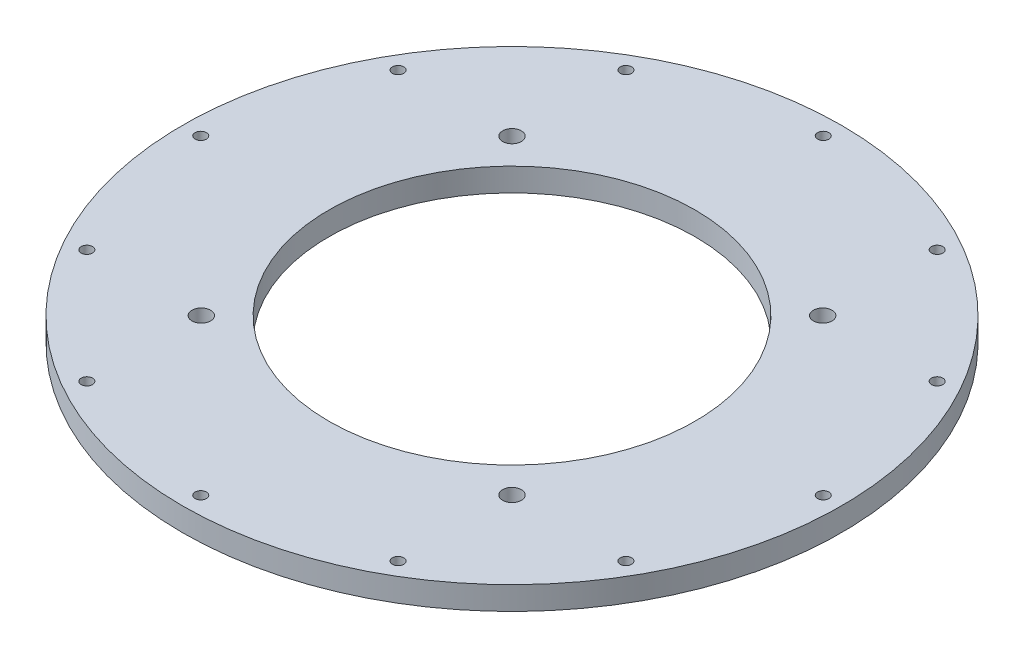
from build123d import *

# Parameters (mm, degrees)
CUT_EXTRUDE1_START       = -6.35
CUT_EXTRUDE1_OUTLINE_R   = 2.55
CUT_EXTRUDE1_OUTLINE_R_2 = 1.55
CUT_EXTRUDE1_DEPTH       = 6.35


# Read off the part's stored shape, not the designer's step: Cut-Extrude1
with BuildPart() as part:
    # Sketch1 → Revolve1 (revolve)
    with BuildSketch(Plane.XY, mode=Mode.PRIVATE) as revolve1_sk:
        with BuildLine():
            Line((90, 6.35), (50, 6.35))
            Line((50, 6.35), (50, 0))
            Line((50, 0), (75.3, 0))
            add(Edge.make_bspline(
                [(81.8, 0), (81.8, 2.165), (78.55, 2.165), (75.3, 2.165), (75.3, 0)],
                knots=[0, 0, 0, 1.570796327, 1.570796327, 3.141592654, 3.141592654, 3.141592654], degree=2, weights=[1, 0.707106781, 1, 0.707106781, 1]))
            Line((81.8, 0), (90, 0))
            Line((90, 0), (90, 6.35))
        make_face()
    revolve(revolve1_sk.sketch.rotate(Axis((0, 0, 0), (0, 1, 0)), 90), axis=Axis((0, 0, 0), (0, 1, 0)))

    # Cut-Extrude1 outline → Cut-Extrude1 (cut)
    with BuildSketch(Plane.XZ.offset(CUT_EXTRUDE1_START)):
        with Locations((-42.426406871, -42.426406871)):
            Circle(CUT_EXTRUDE1_OUTLINE_R)
        with Locations((42.426406871, -42.426406871)):
            Circle(CUT_EXTRUDE1_OUTLINE_R)
        with Locations((42.426406871, 42.426406871)):
            Circle(CUT_EXTRUDE1_OUTLINE_R)
        with Locations((-42.426406871, 42.426406871)):
            Circle(CUT_EXTRUDE1_OUTLINE_R)
        with Locations((-73.612159322, -42.5)):
            Circle(CUT_EXTRUDE1_OUTLINE_R_2)
        with Locations((-42.5, -73.612159322)):
            Circle(CUT_EXTRUDE1_OUTLINE_R_2)
        with Locations((0, -85)):
            Circle(CUT_EXTRUDE1_OUTLINE_R_2)
        with Locations((42.5, -73.612159322)):
            Circle(CUT_EXTRUDE1_OUTLINE_R_2)
        with Locations((73.612159322, -42.5)):
            Circle(CUT_EXTRUDE1_OUTLINE_R_2)
        with Locations((85, 0)):
            Circle(CUT_EXTRUDE1_OUTLINE_R_2)
        with Locations((73.612159322, 42.5)):
            Circle(CUT_EXTRUDE1_OUTLINE_R_2)
        with Locations((42.5, 73.612159322)):
            Circle(CUT_EXTRUDE1_OUTLINE_R_2)
        with Locations((-42.5, 73.612159322)):
            Circle(CUT_EXTRUDE1_OUTLINE_R_2)
        with Locations((-73.612159322, 42.5)):
            Circle(CUT_EXTRUDE1_OUTLINE_R_2)
        with Locations((-85, 0)):
            Circle(CUT_EXTRUDE1_OUTLINE_R_2)
        with Locations((0, 85)):
            Circle(CUT_EXTRUDE1_OUTLINE_R_2)
    extrude(amount=CUT_EXTRUDE1_DEPTH, mode=Mode.SUBTRACT)


solid = part.part
